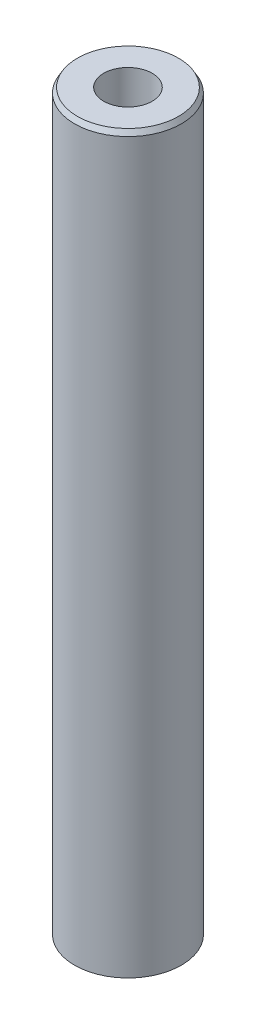
from build123d import *
from OCP.BRepFilletAPI import BRepFilletAPI_MakeChamfer

# Parameters (mm, degrees)
SKETCH1_R           = 5
BOSS_EXTRUDE1_DEPTH = 68.958527814
SKETCH2_R           = 2.272405471
CUT_EXTRUDE1_DEPTH  = 70.320116548
CHAMFER1_SIZE       = 0.466862613
CHAMFER1_SIZE2      = 0.269543255


with BuildPart() as part:
    # Sketch1 → Boss-Extrude1 (new body)
    with BuildSketch(Plane(origin=(0, 0, 0), x_dir=(1, 0, 0), z_dir=(0, 1, 0))):
        Circle(SKETCH1_R)
    extrude(amount=BOSS_EXTRUDE1_DEPTH)

    # Sketch2 → Cut-Extrude1 (cut, through all)
    with BuildSketch(Plane(origin=(0, 0, 0), x_dir=(1, 0, 0), z_dir=(0, 1, 0))):
        Circle(SKETCH2_R)
    extrude(amount=CUT_EXTRUDE1_DEPTH, mode=Mode.SUBTRACT)

    # Chamfer1: one chamfer whose edges measure the first distance from different faces: ONE call of the kernel's chamfer builder (chamfer() names one face for all edges)
    chamfer1_edges_1 = [part.edges().sort_by_distance(p)[0] for p in [
        (-5, 68.958527814, 0),
    ]]
    chamfer1_side_1 = [part.faces().sort_by_distance(p)[0] for p in [
        (-5, 34.479263907, 0),
    ]]
    chamfer1_edges_2 = [part.edges().sort_by_distance(p)[0] for p in [
        (-5, 0, 0),
    ]]
    chamfer1_side_2 = [part.faces().sort_by_distance(p)[0] for p in [
        (-4.858578644, 0, 0),
    ]]
    chamfer1 = BRepFilletAPI_MakeChamfer(part.part.solid().wrapped)
    for e in chamfer1_edges_1:
        chamfer1.Add(CHAMFER1_SIZE, CHAMFER1_SIZE2, e.wrapped, chamfer1_side_1[0].wrapped)  # the first distance lies on this face
    for e in chamfer1_edges_2:
        chamfer1.Add(CHAMFER1_SIZE, CHAMFER1_SIZE2, e.wrapped, chamfer1_side_2[0].wrapped)  # the first distance lies on this face
    add(Compound.cast(chamfer1.Shape()), mode=Mode.REPLACE)


solid = part.part
